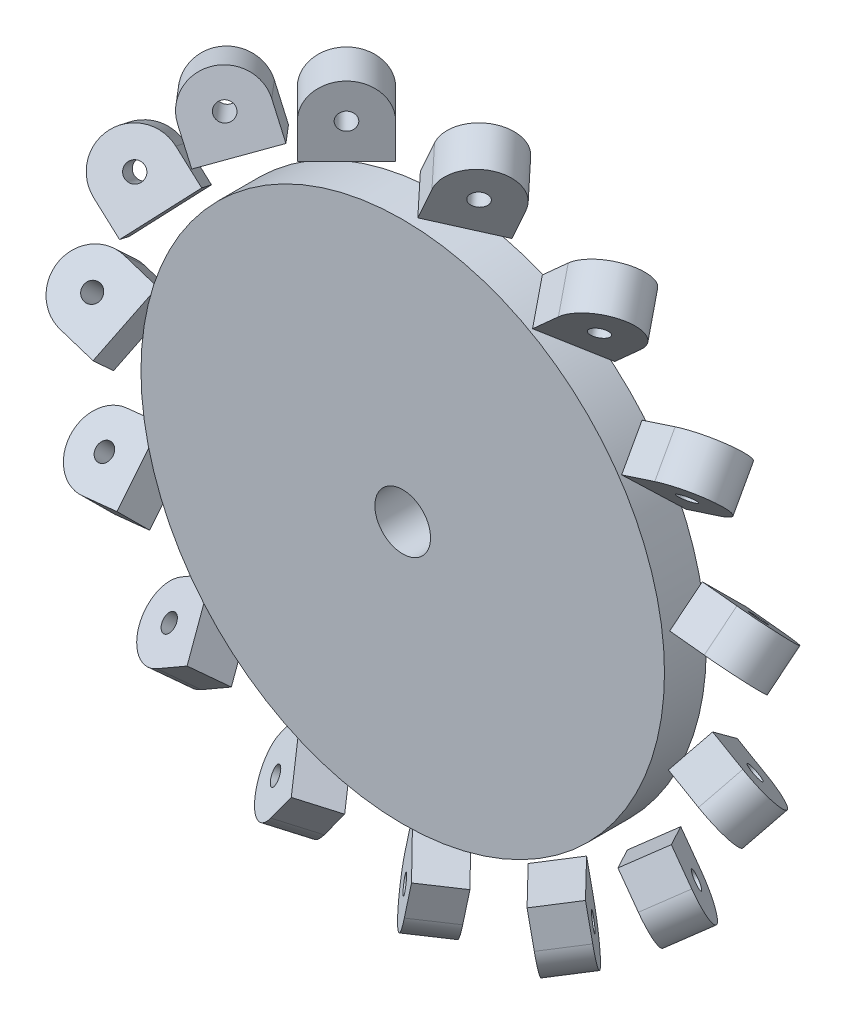
from build123d import *

# Parameters (mm, degrees)
ESQUISSE1_R                     = 25
BOSS_EXTRU_1_DEPTH              = 1
ESQUISSE2_R                     = 5
BOSS_EXTRU_2_DEPTH              = 1
ESQUISSE3_R                     = 25
BOSS_EXTRU_3_DEPTH              = 1
BOSS_EXTRU_4_DEPTH              = 30
BOSS_EXTRU_4_2_DEPTH            = 30
ESQUISSE8_R                     = 0.625877837
ESQUISSE8_W                     = 5
ESQUISSE8_H                     = 19.963127166
ENL_V_MAT_EXTRU_1_DEPTH         = 40
ESQUISSE9_W                     = 5
ESQUISSE9_H                     = 3
BOSS_EXTRU_5_DEPTH              = 17
BOSS_EXTRU_5_2_DEPTH            = 17
R_P_TITION_CIRCULAIRE7_ANGLE    = 24
R_P_TITION_CIRCULAIRE7_2_ANGLE  = 48
R_P_TITION_CIRCULAIRE7_3_ANGLE  = 72
R_P_TITION_CIRCULAIRE7_4_ANGLE  = 96
R_P_TITION_CIRCULAIRE7_5_ANGLE  = 120
R_P_TITION_CIRCULAIRE7_6_ANGLE  = 144
R_P_TITION_CIRCULAIRE7_7_ANGLE  = 168
R_P_TITION_CIRCULAIRE7_8_ANGLE  = 168
R_P_TITION_CIRCULAIRE7_9_ANGLE  = 144
R_P_TITION_CIRCULAIRE7_10_ANGLE = 120
R_P_TITION_CIRCULAIRE7_11_ANGLE = 96
R_P_TITION_CIRCULAIRE7_12_ANGLE = 72
R_P_TITION_CIRCULAIRE7_13_ANGLE = 48
R_P_TITION_CIRCULAIRE7_14_ANGLE = 24
R_P_TITION_CIRCULAIRE7_15_ANGLE = 24
R_P_TITION_CIRCULAIRE7_16_ANGLE = 48
R_P_TITION_CIRCULAIRE7_17_ANGLE = 72
R_P_TITION_CIRCULAIRE7_18_ANGLE = 96
R_P_TITION_CIRCULAIRE7_19_ANGLE = 120
R_P_TITION_CIRCULAIRE7_20_ANGLE = 144
R_P_TITION_CIRCULAIRE7_21_ANGLE = 168
R_P_TITION_CIRCULAIRE7_22_ANGLE = 168
R_P_TITION_CIRCULAIRE7_23_ANGLE = 144
R_P_TITION_CIRCULAIRE7_24_ANGLE = 120
R_P_TITION_CIRCULAIRE7_25_ANGLE = 96
R_P_TITION_CIRCULAIRE7_26_ANGLE = 72
R_P_TITION_CIRCULAIRE7_27_ANGLE = 48
R_P_TITION_CIRCULAIRE7_28_ANGLE = 24
ENL_V_MAT_EXTRU_4_DEPTH         = 38.784630737
ENL_V_MAT_EXTRU_4_DEPTH_BACK    = 38.784630737
ESQUISSE14_W                    = 53.006752219
ESQUISSE14_H                    = 11.116906058
ESQUISSE15_R                    = 18.80571389
ESQUISSE15_R_2                  = 2
BOSS_EXTRU_7_DEPTH              = 3


with BuildPart() as part:
    # Esquisse1 → Boss.-Extru.1 (new body)
    with BuildSketch(Plane.XY):
        Circle(ESQUISSE1_R)
    extrude(amount=BOSS_EXTRU_1_DEPTH)

    # Esquisse2 → Boss.-Extru.2 (add)
    with BuildSketch(Plane.XY.offset(1)):
        Circle(ESQUISSE2_R)
    extrude(amount=BOSS_EXTRU_2_DEPTH)

    # Esquisse3 → Boss.-Extru.3 (add)
    with BuildSketch(Plane.XY.offset(2)):
        Circle(ESQUISSE3_R)
    extrude(amount=BOSS_EXTRU_3_DEPTH)


with BuildPart() as body_2:
    # Esquisse6 → Boss.-Extru.4 (new body)
    with BuildSketch(Plane(origin=(0, 0, 0), x_dir=(1, 0, 0), z_dir=(0, 1, 0))):
        Polygon((-4.833718732, 6.656854249), (-2.712398388, 4.535533906), (-6.247932294, 1), (-8.369252638, 3.121320344), align=None)
    extrude(amount=BOSS_EXTRU_4_DEPTH)


with BuildPart() as body_3:
    # Esquisse6 → Boss.-Extru.4 2 (new body)
    with BuildSketch(Plane(origin=(0, 0, 0), x_dir=(1, 0, 0), z_dir=(0, 1, 0))):
        Polygon((7.944455861, -6.121320344), (4.408921955, -9.656854249), (2.287601612, -7.535533906), (5.823135518, -4), align=None)
    extrude(amount=BOSS_EXTRU_4_2_DEPTH)


with BuildPart() as enl_v_mat_extru_1_tool:
    # Esquisse8 → Enlèv. mat.-Extru.1 (new body)
    with BuildSketch(Plane(origin=(7.032888102, 0, 7.032888102), x_dir=(0.7071067811865434, 0, -0.7071067811865517), z_dir=(0.7071067811865517, 0, 0.7071067811865434))):
        with Locations((-1.210848512, 22.463127166)):
            Circle(ESQUISSE8_R)
        with BuildLine():
            Line((-3.710848512, 22.463127166), (-3.710848512, 30))
            Line((-3.710848512, 30), (1.289151488, 30))
            Line((1.289151488, 30), (1.289151488, 22.463127166))
            ThreePointArc((1.289151488, 22.463127166), (-1.210848512, 24.963127166), (-3.710848512, 22.463127166))
        make_face()
        with Locations((-1.210848512, 9.981563583)):
            Rectangle(ESQUISSE8_W, ESQUISSE8_H)
    extrude(amount=-ENL_V_MAT_EXTRU_1_DEPTH)


with BuildPart() as part_1:
    add(part.part)

    # Enlèv. mat.-Extru.1: cut by enl_v_mat_extru_1_tool
    add(enl_v_mat_extru_1_tool.part, mode=Mode.SUBTRACT)


with BuildPart() as body_2_1:
    add(body_2.part)

    # Enlèv. mat.-Extru.1: cut by enl_v_mat_extru_1_tool
    add(enl_v_mat_extru_1_tool.part, mode=Mode.SUBTRACT)


with BuildPart() as body_3_1:
    add(body_3.part)

    # Enlèv. mat.-Extru.1: cut by enl_v_mat_extru_1_tool
    add(enl_v_mat_extru_1_tool.part, mode=Mode.SUBTRACT)


with BuildPart() as body_4:
    # Esquisse9 → Boss.-Extru.5 (new body)
    with BuildSketch(Plane(origin=(0, 0, 0), x_dir=(1, 0, 0), z_dir=(0, 1, 0))):
        with Locations((-5.540825513, 3.828427125)):
            Rectangle(ESQUISSE9_W, ESQUISSE9_H)
    extrude(amount=BOSS_EXTRU_5_DEPTH)


with BuildPart() as body_5:
    # Esquisse9 → Boss.-Extru.5 2 (new body)
    with BuildSketch(Plane(origin=(0, 0, 0), x_dir=(1, 0, 0), z_dir=(0, 1, 0))):
        with Locations((5.116028737, -6.828427125)):
            Rectangle(ESQUISSE9_W, ESQUISSE9_H)
    extrude(amount=BOSS_EXTRU_5_2_DEPTH)


with BuildPart() as body_6:
    # Répétition circulaire7: read off the stored shape, not the designer's step
    # Répétition circulaire7: copy of body 2
    add(body_2_1.part.rotate(Axis((0, 0, 0), (0, 0, -1)), R_P_TITION_CIRCULAIRE7_ANGLE))


with BuildPart() as body_7:
    # R_p_tition circulaire7 2: copy of body 2
    add(body_2_1.part.rotate(Axis((0, 0, 0), (0, 0, -1)), R_P_TITION_CIRCULAIRE7_2_ANGLE))


with BuildPart() as body_8:
    # R_p_tition circulaire7 3: copy of body 2
    add(body_2_1.part.rotate(Axis((0, 0, 0), (0, 0, -1)), R_P_TITION_CIRCULAIRE7_3_ANGLE))


with BuildPart() as body_9:
    # R_p_tition circulaire7 4: copy of body 2
    add(body_2_1.part.rotate(Axis((0, 0, 0), (0, 0, -1)), R_P_TITION_CIRCULAIRE7_4_ANGLE))


with BuildPart() as body_10:
    # R_p_tition circulaire7 5: copy of body 2
    add(body_2_1.part.rotate(Axis((0, 0, 0), (0, 0, -1)), R_P_TITION_CIRCULAIRE7_5_ANGLE))


with BuildPart() as body_11:
    # R_p_tition circulaire7 6: copy of body 2
    add(body_2_1.part.rotate(Axis((0, 0, 0), (0, 0, -1)), R_P_TITION_CIRCULAIRE7_6_ANGLE))


with BuildPart() as body_12:
    # R_p_tition circulaire7 7: copy of body 2
    add(body_2_1.part.rotate(Axis((0, 0, 0), (0, 0, -1)), R_P_TITION_CIRCULAIRE7_7_ANGLE))


with BuildPart() as body_13:
    # R_p_tition circulaire7 8: copy of body 2
    add(body_2_1.part.rotate(Axis((0, 0, 0), (0, 0, 1)), R_P_TITION_CIRCULAIRE7_8_ANGLE))


with BuildPart() as body_14:
    # R_p_tition circulaire7 9: copy of body 2
    add(body_2_1.part.rotate(Axis((0, 0, 0), (0, 0, 1)), R_P_TITION_CIRCULAIRE7_9_ANGLE))


with BuildPart() as body_15:
    # R_p_tition circulaire7 10: copy of body 2
    add(body_2_1.part.rotate(Axis((0, 0, 0), (0, 0, 1)), R_P_TITION_CIRCULAIRE7_10_ANGLE))


with BuildPart() as body_16:
    # R_p_tition circulaire7 11: copy of body 2
    add(body_2_1.part.rotate(Axis((0, 0, 0), (0, 0, 1)), R_P_TITION_CIRCULAIRE7_11_ANGLE))


with BuildPart() as body_17:
    # R_p_tition circulaire7 12: copy of body 2
    add(body_2_1.part.rotate(Axis((0, 0, 0), (0, 0, 1)), R_P_TITION_CIRCULAIRE7_12_ANGLE))


with BuildPart() as body_18:
    # R_p_tition circulaire7 13: copy of body 2
    add(body_2_1.part.rotate(Axis((0, 0, 0), (0, 0, 1)), R_P_TITION_CIRCULAIRE7_13_ANGLE))


with BuildPart() as body_19:
    # R_p_tition circulaire7 14: copy of body 2
    add(body_2_1.part.rotate(Axis((0, 0, 0), (0, 0, 1)), R_P_TITION_CIRCULAIRE7_14_ANGLE))


with BuildPart() as body_20:
    # R_p_tition circulaire7 15: copy of body 4
    add(body_4.part.rotate(Axis((0, 0, 0), (0, 0, -1)), R_P_TITION_CIRCULAIRE7_15_ANGLE))


with BuildPart() as body_21:
    # R_p_tition circulaire7 16: copy of body 4
    add(body_4.part.rotate(Axis((0, 0, 0), (0, 0, -1)), R_P_TITION_CIRCULAIRE7_16_ANGLE))


with BuildPart() as body_22:
    # R_p_tition circulaire7 17: copy of body 4
    add(body_4.part.rotate(Axis((0, 0, 0), (0, 0, -1)), R_P_TITION_CIRCULAIRE7_17_ANGLE))


with BuildPart() as body_23:
    # R_p_tition circulaire7 18: copy of body 4
    add(body_4.part.rotate(Axis((0, 0, 0), (0, 0, -1)), R_P_TITION_CIRCULAIRE7_18_ANGLE))


with BuildPart() as body_24:
    # R_p_tition circulaire7 19: copy of body 4
    add(body_4.part.rotate(Axis((0, 0, 0), (0, 0, -1)), R_P_TITION_CIRCULAIRE7_19_ANGLE))


with BuildPart() as body_25:
    # R_p_tition circulaire7 20: copy of body 4
    add(body_4.part.rotate(Axis((0, 0, 0), (0, 0, -1)), R_P_TITION_CIRCULAIRE7_20_ANGLE))


with BuildPart() as body_26:
    # R_p_tition circulaire7 21: copy of body 4
    add(body_4.part.rotate(Axis((0, 0, 0), (0, 0, -1)), R_P_TITION_CIRCULAIRE7_21_ANGLE))


with BuildPart() as body_27:
    # R_p_tition circulaire7 22: copy of body 4
    add(body_4.part.rotate(Axis((0, 0, 0), (0, 0, 1)), R_P_TITION_CIRCULAIRE7_22_ANGLE))


with BuildPart() as body_28:
    # R_p_tition circulaire7 23: copy of body 4
    add(body_4.part.rotate(Axis((0, 0, 0), (0, 0, 1)), R_P_TITION_CIRCULAIRE7_23_ANGLE))


with BuildPart() as body_29:
    # R_p_tition circulaire7 24: copy of body 4
    add(body_4.part.rotate(Axis((0, 0, 0), (0, 0, 1)), R_P_TITION_CIRCULAIRE7_24_ANGLE))


with BuildPart() as body_30:
    # R_p_tition circulaire7 25: copy of body 4
    add(body_4.part.rotate(Axis((0, 0, 0), (0, 0, 1)), R_P_TITION_CIRCULAIRE7_25_ANGLE))


with BuildPart() as body_31:
    # R_p_tition circulaire7 26: copy of body 4
    add(body_4.part.rotate(Axis((0, 0, 0), (0, 0, 1)), R_P_TITION_CIRCULAIRE7_26_ANGLE))


with BuildPart() as body_32:
    # R_p_tition circulaire7 27: copy of body 4
    add(body_4.part.rotate(Axis((0, 0, 0), (0, 0, 1)), R_P_TITION_CIRCULAIRE7_27_ANGLE))


with BuildPart() as body_33:
    # R_p_tition circulaire7 28: copy of body 4
    add(body_4.part.rotate(Axis((0, 0, 0), (0, 0, 1)), R_P_TITION_CIRCULAIRE7_28_ANGLE))


with BuildPart() as enl_v_mat_extru_4_tool:
    # Esquisse14 → Enlèv. mat.-Extru.4 (new, two sides: drawn at the far end of the back side and taken through both)
    with BuildSketch(Plane(origin=(0, 0, 0), x_dir=(1, 0, 0), z_dir=(0, 1, 0)).offset(-ENL_V_MAT_EXTRU_4_DEPTH_BACK)):
        with Locations((0.251455182, -4.770210879)):
            Rectangle(ESQUISSE14_W, ESQUISSE14_H)
    extrude(amount=ENL_V_MAT_EXTRU_4_DEPTH + ENL_V_MAT_EXTRU_4_DEPTH_BACK)


with BuildPart() as part_2:
    add(part_1.part)

    # Enlèv. mat.-Extru.4: cut by enl_v_mat_extru_4_tool
    add(enl_v_mat_extru_4_tool.part, mode=Mode.SUBTRACT)


with BuildPart() as body_3_2:
    add(body_3_1.part)

    # Enlèv. mat.-Extru.4: cut by enl_v_mat_extru_4_tool
    add(enl_v_mat_extru_4_tool.part, mode=Mode.SUBTRACT)


with BuildPart() as body_5_1:
    add(body_5.part)

    # Enlèv. mat.-Extru.4: cut by enl_v_mat_extru_4_tool
    add(enl_v_mat_extru_4_tool.part, mode=Mode.SUBTRACT)


with BuildPart() as body_4_1:
    add(body_4.part)

    add(body_20.part)  # Boss.-Extru.7 merges body 20

    add(body_21.part)  # Boss.-Extru.7 merges body 21

    add(body_22.part)  # Boss.-Extru.7 merges body 22

    add(body_23.part)  # Boss.-Extru.7 merges body 23

    add(body_24.part)  # Boss.-Extru.7 merges body 24

    add(body_25.part)  # Boss.-Extru.7 merges body 25

    add(body_26.part)  # Boss.-Extru.7 merges body 26

    add(body_27.part)  # Boss.-Extru.7 merges body 27

    add(body_28.part)  # Boss.-Extru.7 merges body 28

    add(body_29.part)  # Boss.-Extru.7 merges body 29

    add(body_30.part)  # Boss.-Extru.7 merges body 30

    add(body_31.part)  # Boss.-Extru.7 merges body 31

    add(body_32.part)  # Boss.-Extru.7 merges body 32

    add(body_33.part)  # Boss.-Extru.7 merges body 33
    # Esquisse15 → Boss.-Extru.7 (add)
    with BuildSketch(Plane(origin=(0, 0, -5.328427125), x_dir=(-1, 0, 0), z_dir=(0, 0, -1))):
        Circle(ESQUISSE15_R)
        Circle(ESQUISSE15_R_2, mode=Mode.SUBTRACT)
    extrude(amount=-BOSS_EXTRU_7_DEPTH)


solid = Compound([body_2_1.part, body_6.part, body_7.part, body_8.part, body_9.part, body_10.part, body_11.part, body_12.part, body_13.part, body_14.part, body_15.part, body_16.part, body_17.part, body_18.part, body_19.part, body_4_1.part])
